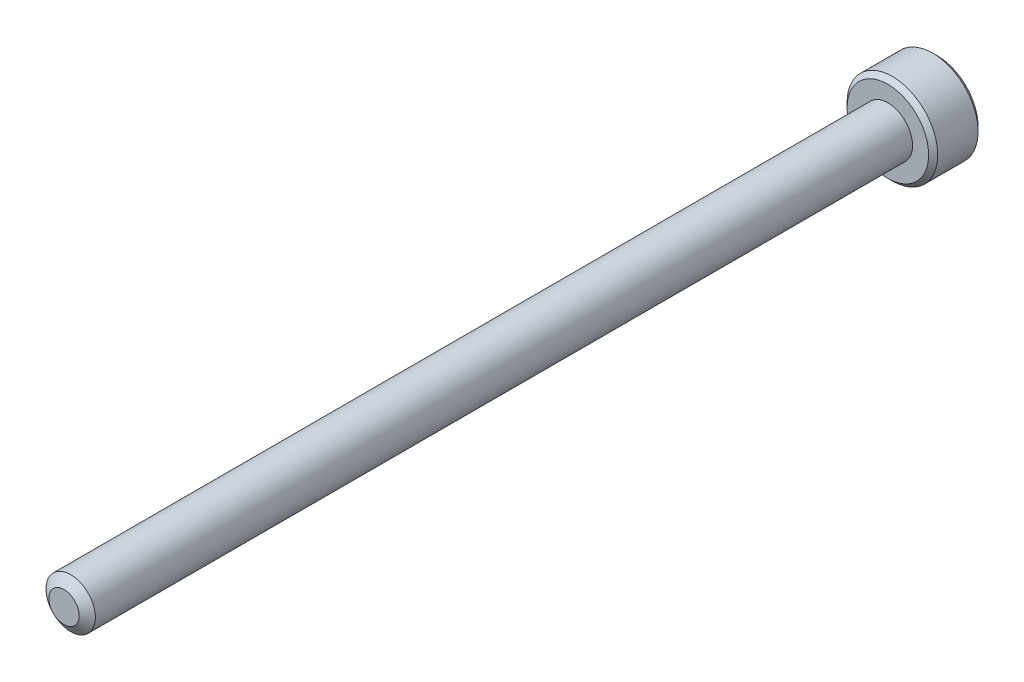
from build123d import *

# Parameters (mm, degrees)
SKETCH1_R          = 1.5
EXTRUDE1_DEPTH     = 50
SKETCH6_R          = 2.75
EXTRUDE2_DEPTH     = 3
CUT_EXTRUDE1_DEPTH = 1.875
CHAMFER1_SIZE      = 0.275


with BuildPart() as part:
    # Sketch1 → Extrude1 (new body)
    with BuildSketch(Plane.XY):
        Circle(SKETCH1_R)
    extrude(amount=-EXTRUDE1_DEPTH)

    # Sketch4 → Cut-Revolve1 (revolve, cut)
    with BuildSketch(Plane(origin=(0, 0, 0), x_dir=(0, 0, -1), z_dir=(1, 0, 0))):
        Polygon((0.405251783, 1.5), (0, 0.921240474), (0, 1.5), align=None)
    revolve(axis=Axis((0, 0, 0), (0, 0, -1)), mode=Mode.SUBTRACT)

    # Sketch6 → Extrude2 (add)
    with BuildSketch(Plane(origin=(0, 0, -50), x_dir=(-1, 0, 0), z_dir=(0, 0, -1))):
        Circle(SKETCH6_R)
    extrude(amount=EXTRUDE2_DEPTH)

    # Sketch7 → Cut-Extrude1 (cut)
    with BuildSketch(Plane(origin=(0, 0, -53), x_dir=(-1, 0, 0), z_dir=(0, 0, -1))):
        Polygon((0, 1.443375673), (-1.25, 0.721687836), (-1.25, -0.721687836), (0, -1.443375673), (1.25, -0.721687836), (1.25, 0.721687836), align=None)
    extrude(amount=-CUT_EXTRUDE1_DEPTH, mode=Mode.SUBTRACT)

    # Cut-Extrude2 cone 1 section (through the dimple's axis) → Cut-Extrude2 (revolve, cut)
    with BuildSketch(Plane(origin=(0, 0, -53), x_dir=(0, 1, 0), z_dir=(1, 0, 0))):
        Polygon((0, 0), (1.443375673, 0), (0, 1.443375673), align=None)
    revolve(axis=Axis((0, 0, -53), (0, 0, 1)), mode=Mode.SUBTRACT)

    # Chamfer1
    chamfer1_edges = [part.edges().sort_by_distance(p)[0] for p in [
        (2.75, 0, -53),
        (2.75, 0, -50),
    ]]
    chamfer(chamfer1_edges, length=CHAMFER1_SIZE)


solid = part.part
